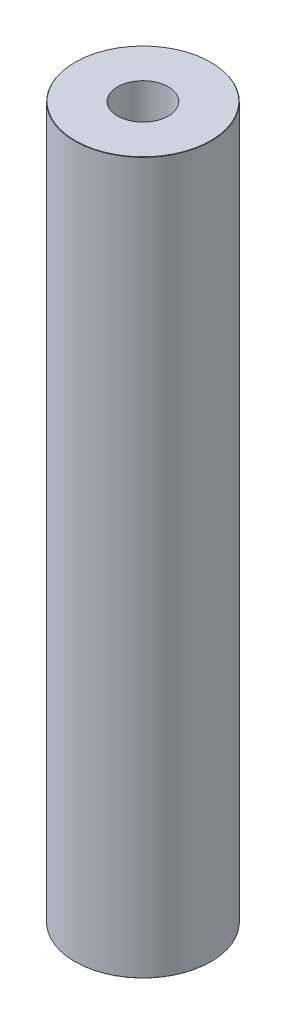
from build123d import *

# Parameters (mm, degrees)
SKETCH1_R           = 57.5
BOSS_EXTRUDE1_DEPTH = 600
SKETCH2_R           = 21.407007126
CUT_EXTRUDE1_DEPTH  = 606.485342515
CHAMFER1_SIZE       = 0.249153503


with BuildPart() as part:
    # Sketch1 → Boss-Extrude1 (new body)
    with BuildSketch(Plane(origin=(0, 0, 0), x_dir=(1, 0, 0), z_dir=(0, 1, 0))):
        Circle(SKETCH1_R)
    extrude(amount=BOSS_EXTRUDE1_DEPTH)

    # Sketch2 → Cut-Extrude1 (cut, through all)
    with BuildSketch(Plane(origin=(0, 0, 0), x_dir=(1, 0, 0), z_dir=(0, 1, 0))):
        Circle(SKETCH2_R)
    extrude(amount=CUT_EXTRUDE1_DEPTH, mode=Mode.SUBTRACT)

    # Chamfer1
    chamfer1_edges = [part.edges().sort_by_distance(p)[0] for p in [
        (-57.5, 600, 0),
        (-57.5, 0, 0),
    ]]
    chamfer(chamfer1_edges, length=CHAMFER1_SIZE)


solid = part.part
